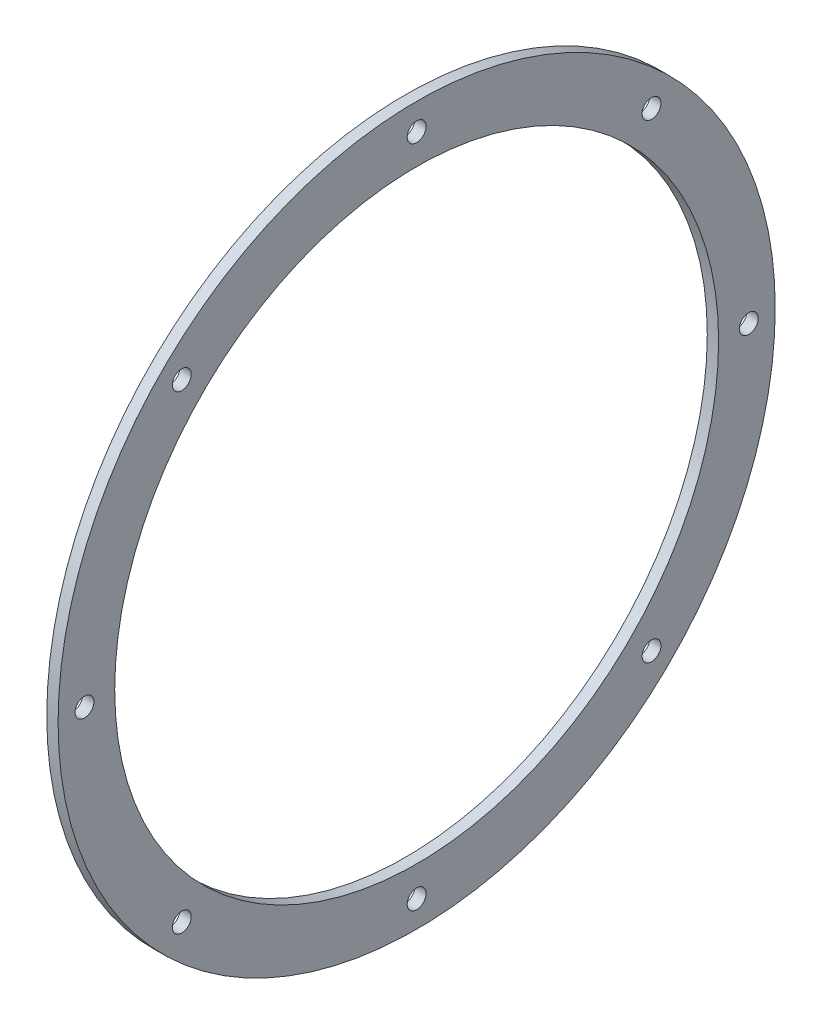
from build123d import *

# Parameters (mm, degrees)
SZKIC1_R                    = 95
SZKIC1_R_2                  = 80
SZKIC1_R_3                  = 2.5
DODANIE_WYCI_GNI_CIE1_DEPTH = 3


with BuildPart() as part:
    # Szkic1 → Dodanie-wyciągnięcie1 (new body)
    with BuildSketch(Plane(origin=(0, 0, 0), x_dir=(0, 0, -1), z_dir=(1, 0, 0))):
        Circle(SZKIC1_R)
        Circle(SZKIC1_R_2, mode=Mode.SUBTRACT)
        with Locations((0, 88)):
            Circle(SZKIC1_R_3, mode=Mode.SUBTRACT)
        with Locations((62.225396744, 62.225396744)):
            Circle(SZKIC1_R_3, mode=Mode.SUBTRACT)
        with Locations((88, 0)):
            Circle(SZKIC1_R_3, mode=Mode.SUBTRACT)
        with Locations((62.225396744, -62.225396744)):
            Circle(SZKIC1_R_3, mode=Mode.SUBTRACT)
        with Locations((0, -88)):
            Circle(SZKIC1_R_3, mode=Mode.SUBTRACT)
        with Locations((-62.225396744, -62.225396744)):
            Circle(SZKIC1_R_3, mode=Mode.SUBTRACT)
        with Locations((-88, 0)):
            Circle(SZKIC1_R_3, mode=Mode.SUBTRACT)
        with Locations((-62.225396744, 62.225396744)):
            Circle(SZKIC1_R_3, mode=Mode.SUBTRACT)
    extrude(amount=DODANIE_WYCI_GNI_CIE1_DEPTH)


solid = part.part
